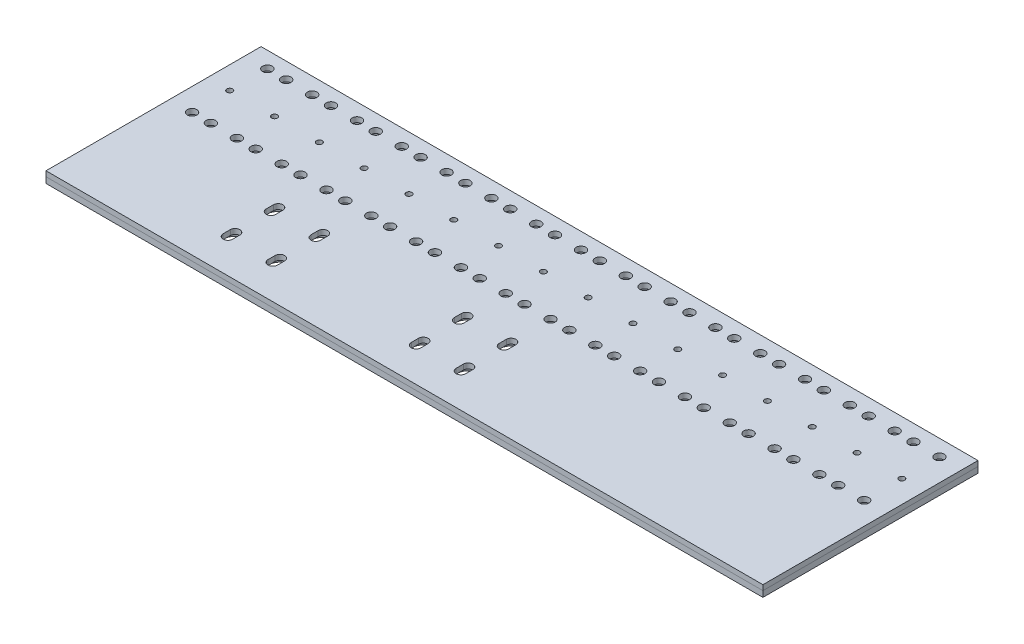
from build123d import *

# Parameters (mm, degrees)
SKETCH1_W           = 400
SKETCH1_H           = 120
SKETCH1_R           = 2.65
SKETCH1_R_2         = 1.6
BOSS_EXTRUDE1_DEPTH = 2.89
SKETCH2_W           = 400
SKETCH2_H           = 120
SKETCH2_R           = 4
SKETCH2_R_2         = 6
BOSS_EXTRUDE2_DEPTH = 3.27


with BuildPart() as part:
    # Sketch1 → Boss-Extrude1 (new body)
    with BuildSketch(Plane(origin=(0, 0, 0), x_dir=(1, 0, 0), z_dir=(0, 1, 0))):
        Rectangle(SKETCH1_W, SKETCH1_H)
        with BuildLine():
            ThreePointArc((-114.85, -41), (-117.5, -43.65), (-120.15, -41))
            Line((-120.15, -41), (-120.15, -37))
            ThreePointArc((-120.15, -37), (-117.5, -34.35), (-114.85, -37))
            Line((-114.85, -37), (-114.85, -41))
        make_face(mode=Mode.SUBTRACT)
        with BuildLine():
            ThreePointArc((-89.85, -41), (-92.5, -43.65), (-95.15, -41))
            Line((-95.15, -41), (-95.15, -37))
            ThreePointArc((-95.15, -37), (-92.5, -34.35), (-89.85, -37))
            Line((-89.85, -37), (-89.85, -41))
        make_face(mode=Mode.SUBTRACT)
        with BuildLine():
            Line((-15.15, -41), (-15.15, -37))
            ThreePointArc((-15.15, -37), (-12.5, -34.35), (-9.85, -37))
            Line((-9.85, -37), (-9.85, -41))
            ThreePointArc((-9.85, -41), (-12.5, -43.65), (-15.15, -41))
        make_face(mode=Mode.SUBTRACT)
        with BuildLine():
            Line((-120.15, -17), (-120.15, -13))
            ThreePointArc((-120.15, -13), (-117.5, -10.35), (-114.85, -13))
            Line((-114.85, -13), (-114.85, -17))
            ThreePointArc((-114.85, -17), (-117.5, -19.65), (-120.15, -17))
        make_face(mode=Mode.SUBTRACT)
        with BuildLine():
            Line((-95.15, -17), (-95.15, -13))
            ThreePointArc((-95.15, -13), (-92.5, -10.35), (-89.85, -13))
            Line((-89.85, -13), (-89.85, -17))
            ThreePointArc((-89.85, -17), (-92.5, -19.65), (-95.15, -17))
        make_face(mode=Mode.SUBTRACT)
        with BuildLine():
            Line((-15.15, -17), (-15.15, -13))
            ThreePointArc((-15.15, -13), (-12.5, -10.35), (-9.85, -13))
            Line((-9.85, -13), (-9.85, -17))
            ThreePointArc((-9.85, -17), (-12.5, -19.65), (-15.15, -17))
        make_face(mode=Mode.SUBTRACT)
        with BuildLine():
            Line((9.85, -41), (9.85, -37))
            ThreePointArc((9.85, -37), (12.5, -34.35), (15.15, -37))
            Line((15.15, -37), (15.15, -41))
            ThreePointArc((15.15, -41), (12.5, -43.65), (9.85, -41))
        make_face(mode=Mode.SUBTRACT)
        with BuildLine():
            Line((9.85, -17), (9.85, -13))
            ThreePointArc((9.85, -13), (12.5, -10.35), (15.15, -13))
            Line((15.15, -13), (15.15, -17))
            ThreePointArc((15.15, -17), (12.5, -19.65), (9.85, -17))
        make_face(mode=Mode.SUBTRACT)
        with Locations(Location((-187.5, 9, 0), (0, 0, 90))):
            Circle(SKETCH1_R, mode=Mode.SUBTRACT)
        with Locations(Location((-177, 9, 0), (0, 0, 90))):
            Circle(SKETCH1_R, mode=Mode.SUBTRACT)
        with Locations(Location((-162.5, 9, 0), (0, 0, 90))):
            Circle(SKETCH1_R, mode=Mode.SUBTRACT)
        with Locations(Location((-152, 9, 0), (0, 0, 90))):
            Circle(SKETCH1_R, mode=Mode.SUBTRACT)
        with Locations(Location((-137.5, 9, 0), (0, 0, 90))):
            Circle(SKETCH1_R, mode=Mode.SUBTRACT)
        with Locations(Location((-127, 9, 0), (0, 0, 90))):
            Circle(SKETCH1_R, mode=Mode.SUBTRACT)
        with Locations(Location((-112.5, 9, 0), (0, 0, 90))):
            Circle(SKETCH1_R, mode=Mode.SUBTRACT)
        with Locations(Location((-102, 9, 0), (0, 0, 90))):
            Circle(SKETCH1_R, mode=Mode.SUBTRACT)
        with Locations(Location((-87.5, 9, 0), (0, 0, 90))):
            Circle(SKETCH1_R, mode=Mode.SUBTRACT)
        with Locations(Location((-77, 9, 0), (0, 0, 90))):
            Circle(SKETCH1_R, mode=Mode.SUBTRACT)
        with Locations(Location((-62.5, 9, 0), (0, 0, 90))):
            Circle(SKETCH1_R, mode=Mode.SUBTRACT)
        with Locations(Location((-52, 9, 0), (0, 0, 90))):
            Circle(SKETCH1_R, mode=Mode.SUBTRACT)
        with Locations(Location((-37.5, 9, 0), (0, 0, 90))):
            Circle(SKETCH1_R, mode=Mode.SUBTRACT)
        with Locations(Location((-27, 9, 0), (0, 0, 90))):
            Circle(SKETCH1_R, mode=Mode.SUBTRACT)
        with Locations(Location((-12.5, 9, 0), (0, 0, 90))):
            Circle(SKETCH1_R, mode=Mode.SUBTRACT)
        with Locations(Location((-2, 9, 0), (0, 0, 90))):
            Circle(SKETCH1_R, mode=Mode.SUBTRACT)
        with Locations(Location((-187.5, 30, 0), (0, 0, 90))):
            Circle(SKETCH1_R_2, mode=Mode.SUBTRACT)
        with Locations(Location((-162.5, 30, 0), (0, 0, 90))):
            Circle(SKETCH1_R_2, mode=Mode.SUBTRACT)
        with Locations(Location((-137.5, 30, 0), (0, 0, 90))):
            Circle(SKETCH1_R_2, mode=Mode.SUBTRACT)
        with Locations(Location((-112.5, 30, 0), (0, 0, 90))):
            Circle(SKETCH1_R_2, mode=Mode.SUBTRACT)
        with Locations(Location((-187.5, 51, 0), (0, 0, 90))):
            Circle(SKETCH1_R, mode=Mode.SUBTRACT)
        with Locations(Location((-177, 51, 0), (0, 0, 90))):
            Circle(SKETCH1_R, mode=Mode.SUBTRACT)
        with Locations(Location((-162.5, 51, 0), (0, 0, 90))):
            Circle(SKETCH1_R, mode=Mode.SUBTRACT)
        with Locations(Location((-152, 51, 0), (0, 0, 90))):
            Circle(SKETCH1_R, mode=Mode.SUBTRACT)
        with Locations(Location((-137.5, 51, 0), (0, 0, 90))):
            Circle(SKETCH1_R, mode=Mode.SUBTRACT)
        with Locations(Location((-127, 51, 0), (0, 0, 90))):
            Circle(SKETCH1_R, mode=Mode.SUBTRACT)
        with Locations(Location((-112.5, 51, 0), (0, 0, 90))):
            Circle(SKETCH1_R, mode=Mode.SUBTRACT)
        with Locations(Location((-102, 51, 0), (0, 0, 90))):
            Circle(SKETCH1_R, mode=Mode.SUBTRACT)
        with Locations(Location((-87.5, 30, 0), (0, 0, 90))):
            Circle(SKETCH1_R_2, mode=Mode.SUBTRACT)
        with Locations(Location((-62.5, 30, 0), (0, 0, 90))):
            Circle(SKETCH1_R_2, mode=Mode.SUBTRACT)
        with Locations(Location((-37.5, 30, 0), (0, 0, 90))):
            Circle(SKETCH1_R_2, mode=Mode.SUBTRACT)
        with Locations(Location((-12.5, 30, 0), (0, 0, 90))):
            Circle(SKETCH1_R_2, mode=Mode.SUBTRACT)
        with Locations(Location((-87.5, 51, 0), (0, 0, 90))):
            Circle(SKETCH1_R, mode=Mode.SUBTRACT)
        with Locations(Location((-77, 51, 0), (0, 0, 90))):
            Circle(SKETCH1_R, mode=Mode.SUBTRACT)
        with Locations(Location((-62.5, 51, 0), (0, 0, 90))):
            Circle(SKETCH1_R, mode=Mode.SUBTRACT)
        with Locations(Location((-52, 51, 0), (0, 0, 90))):
            Circle(SKETCH1_R, mode=Mode.SUBTRACT)
        with Locations(Location((-37.5, 51, 0), (0, 0, 90))):
            Circle(SKETCH1_R, mode=Mode.SUBTRACT)
        with Locations(Location((-27, 51, 0), (0, 0, 90))):
            Circle(SKETCH1_R, mode=Mode.SUBTRACT)
        with Locations(Location((-12.5, 51, 0), (0, 0, 90))):
            Circle(SKETCH1_R, mode=Mode.SUBTRACT)
        with Locations(Location((-2, 51, 0), (0, 0, 90))):
            Circle(SKETCH1_R, mode=Mode.SUBTRACT)
        with Locations(Location((12.5, 9, 0), (0, 0, 90))):
            Circle(SKETCH1_R, mode=Mode.SUBTRACT)
        with Locations(Location((23, 9, 0), (0, 0, 90))):
            Circle(SKETCH1_R, mode=Mode.SUBTRACT)
        with Locations(Location((37.5, 9, 0), (0, 0, 90))):
            Circle(SKETCH1_R, mode=Mode.SUBTRACT)
        with Locations(Location((48, 9, 0), (0, 0, 90))):
            Circle(SKETCH1_R, mode=Mode.SUBTRACT)
        with Locations(Location((62.5, 9, 0), (0, 0, 90))):
            Circle(SKETCH1_R, mode=Mode.SUBTRACT)
        with Locations(Location((73, 9, 0), (0, 0, 90))):
            Circle(SKETCH1_R, mode=Mode.SUBTRACT)
        with Locations(Location((87.5, 9, 0), (0, 0, 90))):
            Circle(SKETCH1_R, mode=Mode.SUBTRACT)
        with Locations(Location((98, 9, 0), (0, 0, 90))):
            Circle(SKETCH1_R, mode=Mode.SUBTRACT)
        with Locations(Location((112.5, 9, 0), (0, 0, 90))):
            Circle(SKETCH1_R, mode=Mode.SUBTRACT)
        with Locations(Location((123, 9, 0), (0, 0, 90))):
            Circle(SKETCH1_R, mode=Mode.SUBTRACT)
        with Locations(Location((137.5, 9, 0), (0, 0, 90))):
            Circle(SKETCH1_R, mode=Mode.SUBTRACT)
        with Locations(Location((148, 9, 0), (0, 0, 90))):
            Circle(SKETCH1_R, mode=Mode.SUBTRACT)
        with Locations(Location((162.5, 9, 0), (0, 0, 90))):
            Circle(SKETCH1_R, mode=Mode.SUBTRACT)
        with Locations(Location((173, 9, 0), (0, 0, 90))):
            Circle(SKETCH1_R, mode=Mode.SUBTRACT)
        with Locations(Location((187.5, 9, 0), (0, 0, 90))):
            Circle(SKETCH1_R, mode=Mode.SUBTRACT)
        with Locations(Location((12.5, 30, 0), (0, 0, 90))):
            Circle(SKETCH1_R_2, mode=Mode.SUBTRACT)
        with Locations(Location((37.5, 30, 0), (0, 0, 90))):
            Circle(SKETCH1_R_2, mode=Mode.SUBTRACT)
        with Locations(Location((62.5, 30, 0), (0, 0, 90))):
            Circle(SKETCH1_R_2, mode=Mode.SUBTRACT)
        with Locations(Location((87.5, 30, 0), (0, 0, 90))):
            Circle(SKETCH1_R_2, mode=Mode.SUBTRACT)
        with Locations(Location((12.5, 51, 0), (0, 0, 90))):
            Circle(SKETCH1_R, mode=Mode.SUBTRACT)
        with Locations(Location((23, 51, 0), (0, 0, 90))):
            Circle(SKETCH1_R, mode=Mode.SUBTRACT)
        with Locations(Location((37.5, 51, 0), (0, 0, 90))):
            Circle(SKETCH1_R, mode=Mode.SUBTRACT)
        with Locations(Location((48, 51, 0), (0, 0, 90))):
            Circle(SKETCH1_R, mode=Mode.SUBTRACT)
        with Locations(Location((62.5, 51, 0), (0, 0, 90))):
            Circle(SKETCH1_R, mode=Mode.SUBTRACT)
        with Locations(Location((73, 51, 0), (0, 0, 90))):
            Circle(SKETCH1_R, mode=Mode.SUBTRACT)
        with Locations(Location((87.5, 51, 0), (0, 0, 90))):
            Circle(SKETCH1_R, mode=Mode.SUBTRACT)
        with Locations(Location((98, 51, 0), (0, 0, 90))):
            Circle(SKETCH1_R, mode=Mode.SUBTRACT)
        with Locations(Location((112.5, 30, 0), (0, 0, 90))):
            Circle(SKETCH1_R_2, mode=Mode.SUBTRACT)
        with Locations(Location((137.5, 30, 0), (0, 0, 90))):
            Circle(SKETCH1_R_2, mode=Mode.SUBTRACT)
        with Locations(Location((162.5, 30, 0), (0, 0, 90))):
            Circle(SKETCH1_R_2, mode=Mode.SUBTRACT)
        with Locations(Location((187.5, 30, 0), (0, 0, 90))):
            Circle(SKETCH1_R_2, mode=Mode.SUBTRACT)
        with Locations(Location((112.5, 51, 0), (0, 0, 90))):
            Circle(SKETCH1_R, mode=Mode.SUBTRACT)
        with Locations(Location((123, 51, 0), (0, 0, 90))):
            Circle(SKETCH1_R, mode=Mode.SUBTRACT)
        with Locations(Location((137.5, 51, 0), (0, 0, 90))):
            Circle(SKETCH1_R, mode=Mode.SUBTRACT)
        with Locations(Location((148, 51, 0), (0, 0, 90))):
            Circle(SKETCH1_R, mode=Mode.SUBTRACT)
        with Locations(Location((162.5, 51, 0), (0, 0, 90))):
            Circle(SKETCH1_R, mode=Mode.SUBTRACT)
        with Locations(Location((173, 51, 0), (0, 0, 90))):
            Circle(SKETCH1_R, mode=Mode.SUBTRACT)
        with Locations(Location((187.5, 51, 0), (0, 0, 90))):
            Circle(SKETCH1_R, mode=Mode.SUBTRACT)
    extrude(amount=BOSS_EXTRUDE1_DEPTH)


with BuildPart() as body_2:
    # Sketch2 → Boss-Extrude2 (new body)
    with BuildSketch(Plane.XZ):
        Rectangle(SKETCH2_W, SKETCH2_H)
        with BuildLine():
            ThreePointArc((167.75, -6.09526249), (179, -9), (167.75, -11.90473751))
            ThreePointArc((167.75, -11.90473751), (156.5, -9), (167.75, -6.09526249))
        make_face(mode=Mode.SUBTRACT)
        with BuildLine():
            ThreePointArc((167.75, -48.09526249), (179, -51), (167.75, -53.90473751))
            ThreePointArc((167.75, -53.90473751), (156.5, -51), (167.75, -48.09526249))
        make_face(mode=Mode.SUBTRACT)
        with BuildLine():
            ThreePointArc((-182.25, -53.90473751), (-193.5, -51), (-182.25, -48.09526249))
            ThreePointArc((-182.25, -48.09526249), (-171, -51), (-182.25, -53.90473751))
        make_face(mode=Mode.SUBTRACT)
        with BuildLine():
            ThreePointArc((-157.25, -53.90473751), (-168.5, -51), (-157.25, -48.09526249))
            ThreePointArc((-157.25, -48.09526249), (-146, -51), (-157.25, -53.90473751))
        make_face(mode=Mode.SUBTRACT)
        with BuildLine():
            ThreePointArc((-132.25, -53.90473751), (-143.5, -51), (-132.25, -48.09526249))
            ThreePointArc((-132.25, -48.09526249), (-121, -51), (-132.25, -53.90473751))
        make_face(mode=Mode.SUBTRACT)
        with BuildLine():
            ThreePointArc((-107.25, -53.90473751), (-118.5, -51), (-107.25, -48.09526249))
            ThreePointArc((-107.25, -48.09526249), (-96, -51), (-107.25, -53.90473751))
        make_face(mode=Mode.SUBTRACT)
        with BuildLine():
            ThreePointArc((-82.25, -53.90473751), (-93.5, -51), (-82.25, -48.09526249))
            ThreePointArc((-82.25, -48.09526249), (-71, -51), (-82.25, -53.90473751))
        make_face(mode=Mode.SUBTRACT)
        with BuildLine():
            ThreePointArc((-57.25, -53.90473751), (-68.5, -51), (-57.25, -48.09526249))
            ThreePointArc((-57.25, -48.09526249), (-46, -51), (-57.25, -53.90473751))
        make_face(mode=Mode.SUBTRACT)
        with BuildLine():
            ThreePointArc((-32.25, -53.90473751), (-43.5, -51), (-32.25, -48.09526249))
            ThreePointArc((-32.25, -48.09526249), (-21, -51), (-32.25, -53.90473751))
        make_face(mode=Mode.SUBTRACT)
        with Locations(Location((-187.5, -30, 0), (0, 0, 270))):
            Circle(SKETCH2_R, mode=Mode.SUBTRACT)
        with Locations(Location((-162.5, -30, 0), (0, 0, 270))):
            Circle(SKETCH2_R, mode=Mode.SUBTRACT)
        with Locations(Location((-137.5, -30, 0), (0, 0, 270))):
            Circle(SKETCH2_R, mode=Mode.SUBTRACT)
        with BuildLine():
            ThreePointArc((-182.25, -11.90473751), (-193.5, -9), (-182.25, -6.09526249))
            ThreePointArc((-182.25, -6.09526249), (-171, -9), (-182.25, -11.90473751))
        make_face(mode=Mode.SUBTRACT)
        with BuildLine():
            ThreePointArc((-157.25, -11.90473751), (-168.5, -9), (-157.25, -6.09526249))
            ThreePointArc((-157.25, -6.09526249), (-146, -9), (-157.25, -11.90473751))
        make_face(mode=Mode.SUBTRACT)
        with BuildLine():
            ThreePointArc((-132.25, -11.90473751), (-143.5, -9), (-132.25, -6.09526249))
            ThreePointArc((-132.25, -6.09526249), (-121, -9), (-132.25, -11.90473751))
        make_face(mode=Mode.SUBTRACT)
        with Locations(Location((-112.5, -30, 0), (0, 0, 270))):
            Circle(SKETCH2_R, mode=Mode.SUBTRACT)
        with Locations(Location((-87.5, -30, 0), (0, 0, 270))):
            Circle(SKETCH2_R, mode=Mode.SUBTRACT)
        with Locations(Location((-62.5, -30, 0), (0, 0, 270))):
            Circle(SKETCH2_R, mode=Mode.SUBTRACT)
        with Locations(Location((-37.5, -30, 0), (0, 0, 270))):
            Circle(SKETCH2_R, mode=Mode.SUBTRACT)
        with BuildLine():
            ThreePointArc((-107.25, -11.90473751), (-118.5, -9), (-107.25, -6.09526249))
            ThreePointArc((-107.25, -6.09526249), (-96, -9), (-107.25, -11.90473751))
        make_face(mode=Mode.SUBTRACT)
        with BuildLine():
            ThreePointArc((-82.25, -11.90473751), (-93.5, -9), (-82.25, -6.09526249))
            ThreePointArc((-82.25, -6.09526249), (-71, -9), (-82.25, -11.90473751))
        make_face(mode=Mode.SUBTRACT)
        with BuildLine():
            ThreePointArc((-57.25, -11.90473751), (-68.5, -9), (-57.25, -6.09526249))
            ThreePointArc((-57.25, -6.09526249), (-46, -9), (-57.25, -11.90473751))
        make_face(mode=Mode.SUBTRACT)
        with BuildLine():
            ThreePointArc((-32.25, -11.90473751), (-43.5, -9), (-32.25, -6.09526249))
            ThreePointArc((-32.25, -6.09526249), (-21, -9), (-32.25, -11.90473751))
        make_face(mode=Mode.SUBTRACT)
        with BuildLine():
            ThreePointArc((-7.25, -53.90473751), (-18.5, -51), (-7.25, -48.09526249))
            ThreePointArc((-7.25, -48.09526249), (4, -51), (-7.25, -53.90473751))
        make_face(mode=Mode.SUBTRACT)
        with BuildLine():
            ThreePointArc((17.75, -53.90473751), (6.5, -51), (17.75, -48.09526249))
            ThreePointArc((17.75, -48.09526249), (29, -51), (17.75, -53.90473751))
        make_face(mode=Mode.SUBTRACT)
        with BuildLine():
            ThreePointArc((42.75, -53.90473751), (31.5, -51), (42.75, -48.09526249))
            ThreePointArc((42.75, -48.09526249), (54, -51), (42.75, -53.90473751))
        make_face(mode=Mode.SUBTRACT)
        with BuildLine():
            ThreePointArc((67.75, -53.90473751), (56.5, -51), (67.75, -48.09526249))
            ThreePointArc((67.75, -48.09526249), (79, -51), (67.75, -53.90473751))
        make_face(mode=Mode.SUBTRACT)
        with BuildLine():
            ThreePointArc((92.75, -53.90473751), (81.5, -51), (92.75, -48.09526249))
            ThreePointArc((92.75, -48.09526249), (104, -51), (92.75, -53.90473751))
        make_face(mode=Mode.SUBTRACT)
        with BuildLine():
            ThreePointArc((117.75, -53.90473751), (106.5, -51), (117.75, -48.09526249))
            ThreePointArc((117.75, -48.09526249), (129, -51), (117.75, -53.90473751))
        make_face(mode=Mode.SUBTRACT)
        with BuildLine():
            ThreePointArc((142.75, -53.90473751), (131.5, -51), (142.75, -48.09526249))
            ThreePointArc((142.75, -48.09526249), (154, -51), (142.75, -53.90473751))
        make_face(mode=Mode.SUBTRACT)
        with Locations(Location((-12.5, -30, 0), (0, 0, 270))):
            Circle(SKETCH2_R, mode=Mode.SUBTRACT)
        with Locations(Location((12.5, -30, 0), (0, 0, 270))):
            Circle(SKETCH2_R, mode=Mode.SUBTRACT)
        with Locations(Location((37.5, -30, 0), (0, 0, 270))):
            Circle(SKETCH2_R, mode=Mode.SUBTRACT)
        with Locations(Location((62.5, -30, 0), (0, 0, 270))):
            Circle(SKETCH2_R, mode=Mode.SUBTRACT)
        with Locations(Location((87.5, -30, 0), (0, 0, 270))):
            Circle(SKETCH2_R, mode=Mode.SUBTRACT)
        with BuildLine():
            ThreePointArc((-7.25, -11.90473751), (-18.5, -9), (-7.25, -6.09526249))
            ThreePointArc((-7.25, -6.09526249), (4, -9), (-7.25, -11.90473751))
        make_face(mode=Mode.SUBTRACT)
        with BuildLine():
            ThreePointArc((17.75, -11.90473751), (6.5, -9), (17.75, -6.09526249))
            ThreePointArc((17.75, -6.09526249), (29, -9), (17.75, -11.90473751))
        make_face(mode=Mode.SUBTRACT)
        with BuildLine():
            ThreePointArc((42.75, -11.90473751), (31.5, -9), (42.75, -6.09526249))
            ThreePointArc((42.75, -6.09526249), (54, -9), (42.75, -11.90473751))
        make_face(mode=Mode.SUBTRACT)
        with BuildLine():
            ThreePointArc((67.75, -11.90473751), (56.5, -9), (67.75, -6.09526249))
            ThreePointArc((67.75, -6.09526249), (79, -9), (67.75, -11.90473751))
        make_face(mode=Mode.SUBTRACT)
        with BuildLine():
            ThreePointArc((92.75, -11.90473751), (81.5, -9), (92.75, -6.09526249))
            ThreePointArc((92.75, -6.09526249), (104, -9), (92.75, -11.90473751))
        make_face(mode=Mode.SUBTRACT)
        with Locations(Location((112.5, -30, 0), (0, 0, 270))):
            Circle(SKETCH2_R, mode=Mode.SUBTRACT)
        with Locations(Location((137.5, -30, 0), (0, 0, 270))):
            Circle(SKETCH2_R, mode=Mode.SUBTRACT)
        with Locations(Location((162.5, -30, 0), (0, 0, 270))):
            Circle(SKETCH2_R, mode=Mode.SUBTRACT)
        with BuildLine():
            ThreePointArc((117.75, -11.90473751), (106.5, -9), (117.75, -6.09526249))
            ThreePointArc((117.75, -6.09526249), (129, -9), (117.75, -11.90473751))
        make_face(mode=Mode.SUBTRACT)
        with BuildLine():
            ThreePointArc((142.75, -11.90473751), (131.5, -9), (142.75, -6.09526249))
            ThreePointArc((142.75, -6.09526249), (154, -9), (142.75, -11.90473751))
        make_face(mode=Mode.SUBTRACT)
        with BuildLine():
            Line((-123.5, 13), (-123.5, 17))
            ThreePointArc((-123.5, 17), (-117.5, 23), (-111.5, 17))
            Line((-111.5, 17), (-111.5, 13))
            ThreePointArc((-111.5, 13), (-117.5, 7), (-123.5, 13))
        make_face(mode=Mode.SUBTRACT)
        with BuildLine():
            Line((-98.5, 13), (-98.5, 17))
            ThreePointArc((-98.5, 17), (-92.5, 23), (-86.5, 17))
            Line((-86.5, 17), (-86.5, 13))
            ThreePointArc((-86.5, 13), (-92.5, 7), (-98.5, 13))
        make_face(mode=Mode.SUBTRACT)
        with BuildLine():
            Line((-18.5, 13), (-18.5, 17))
            ThreePointArc((-18.5, 17), (-12.5, 23), (-6.5, 17))
            Line((-6.5, 17), (-6.5, 13))
            ThreePointArc((-6.5, 13), (-12.5, 7), (-18.5, 13))
        make_face(mode=Mode.SUBTRACT)
        with BuildLine():
            Line((-123.5, 37), (-123.5, 41))
            ThreePointArc((-123.5, 41), (-117.5, 47), (-111.5, 41))
            Line((-111.5, 41), (-111.5, 37))
            ThreePointArc((-111.5, 37), (-117.5, 31), (-123.5, 37))
        make_face(mode=Mode.SUBTRACT)
        with BuildLine():
            Line((-98.5, 37), (-98.5, 41))
            ThreePointArc((-98.5, 41), (-92.5, 47), (-86.5, 41))
            Line((-86.5, 41), (-86.5, 37))
            ThreePointArc((-86.5, 37), (-92.5, 31), (-98.5, 37))
        make_face(mode=Mode.SUBTRACT)
        with BuildLine():
            Line((-18.5, 37), (-18.5, 41))
            ThreePointArc((-18.5, 41), (-12.5, 47), (-6.5, 41))
            Line((-6.5, 41), (-6.5, 37))
            ThreePointArc((-6.5, 37), (-12.5, 31), (-18.5, 37))
        make_face(mode=Mode.SUBTRACT)
        with BuildLine():
            Line((6.5, 13), (6.5, 17))
            ThreePointArc((6.5, 17), (12.5, 23), (18.5, 17))
            Line((18.5, 17), (18.5, 13))
            ThreePointArc((18.5, 13), (12.5, 7), (6.5, 13))
        make_face(mode=Mode.SUBTRACT)
        with BuildLine():
            Line((6.5, 37), (6.5, 41))
            ThreePointArc((6.5, 41), (12.5, 47), (18.5, 41))
            Line((18.5, 41), (18.5, 37))
            ThreePointArc((18.5, 37), (12.5, 31), (6.5, 37))
        make_face(mode=Mode.SUBTRACT)
        with Locations(Location((187.5, -51, 0), (0, 0, 270))):
            Circle(SKETCH2_R_2, mode=Mode.SUBTRACT)
        with Locations(Location((187.5, -30, 0), (0, 0, 270))):
            Circle(SKETCH2_R, mode=Mode.SUBTRACT)
        with Locations(Location((187.5, -9, 0), (0, 0, 270))):
            Circle(SKETCH2_R_2, mode=Mode.SUBTRACT)
    extrude(amount=BOSS_EXTRUDE2_DEPTH)


solid = Compound([part.part, body_2.part])
